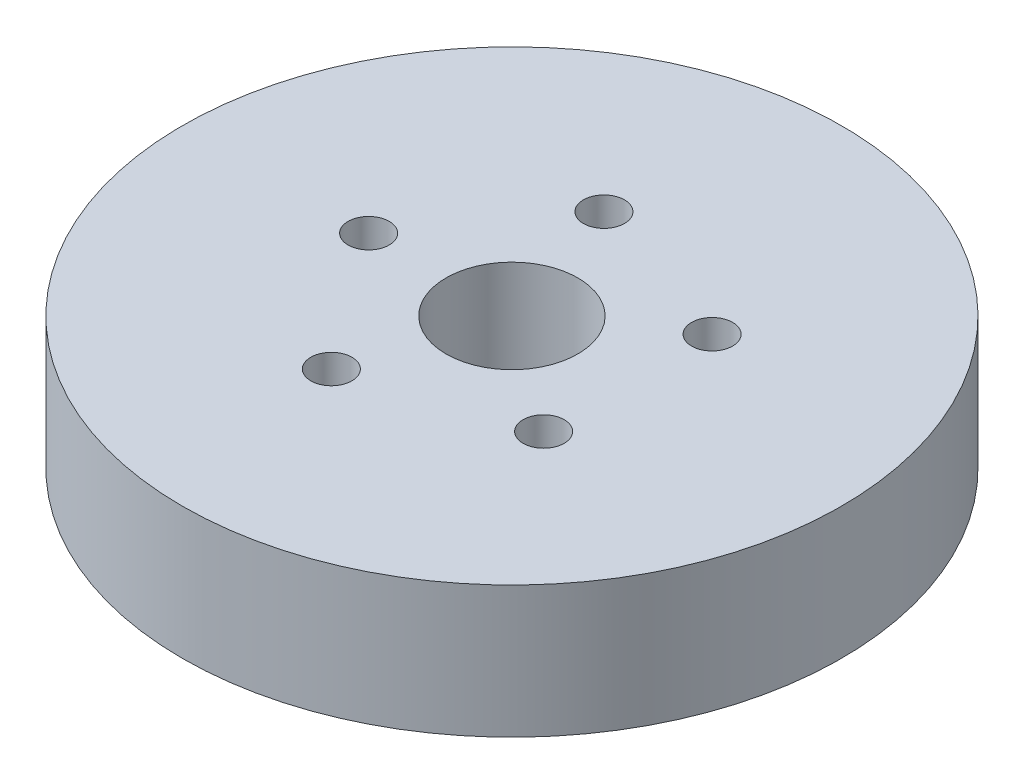
from build123d import *

# Parameters (mm, degrees)
SKETCH1_R           = 50
BOSS_EXTRUDE1_DEPTH = 20
SKETCH2_R           = 10
CUT_EXTRUDE1_DEPTH  = 74.484692283
SKETCH3_R           = 3.114961468
CUT_EXTRUDE2_DEPTH  = 16.157864994
CIRPATTERN1_COUNT   = 5


with BuildPart() as part:
    # Sketch1 → Boss-Extrude1 (new body)
    with BuildSketch(Plane(origin=(0, 0, 0), x_dir=(1, 0, 0), z_dir=(0, 1, 0))):
        Circle(SKETCH1_R)
    extrude(amount=BOSS_EXTRUDE1_DEPTH)

    # Sketch2 → Cut-Extrude1 (cut, through all)
    with BuildSketch(Plane(origin=(0, 0, 0), x_dir=(1, 0, 0), z_dir=(0, 1, 0))):
        Circle(SKETCH2_R)
    extrude(amount=CUT_EXTRUDE1_DEPTH, mode=Mode.SUBTRACT)

    # Sketch3 → Cut-Extrude2 (cut)
    with BuildSketch(Plane(origin=(0, 20, 0), x_dir=(1, 0, 0), z_dir=(0, 1, 0))):
        with Locations((-21.740788441, 0)):
            Circle(SKETCH3_R)
    cut_extrude2 = extrude(amount=-CUT_EXTRUDE2_DEPTH, mode=Mode.SUBTRACT)

    # CirPattern1: Cut-Extrude2 ×5 about axis
    cirpattern1_axis = Axis((0, 0, 0), (0, 1, 0))
    for i in range(1, CIRPATTERN1_COUNT):
        add(cut_extrude2.rotate(cirpattern1_axis, i * 360 / CIRPATTERN1_COUNT), mode=Mode.SUBTRACT)


solid = part.part
